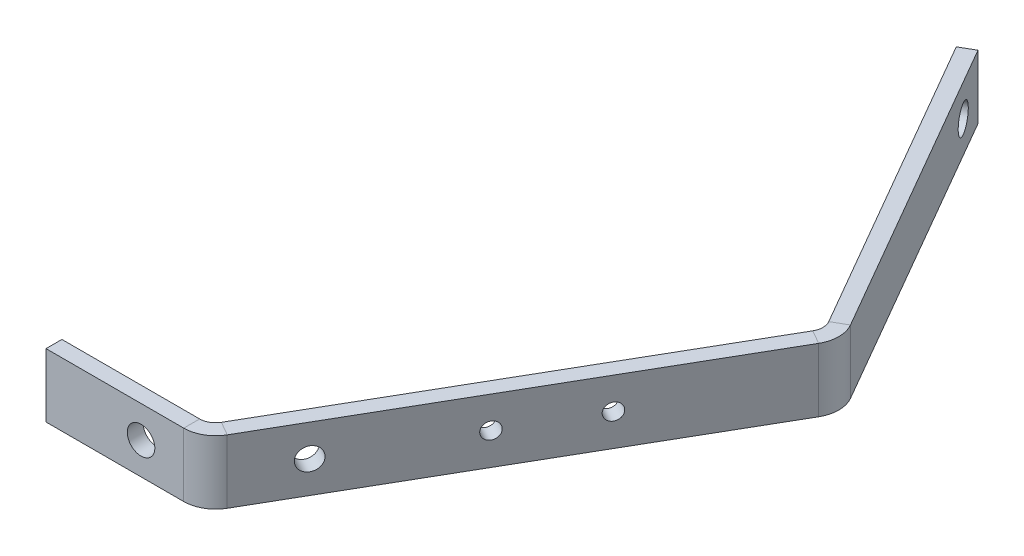
from build123d import *

# Parameters (mm, degrees)
ESBO_O2_W               = 193.5
ESBO_O2_H               = 12.7
FLANGE_BASE1_DEPTH      = 3.175
DOBRA_START             = -6.35
DOBRA_ESBO_ADA1_DEPTH   = 12.7
DOBRA_ESBO_ADA1_2_DEPTH = 12.7
DOBRA_ESBO_ADA2_DEPTH   = 12.7
DOBRA_ESBO_ADA2_2_DEPTH = 12.7
ESBO_O10_R              = 2.75
CORTE_EXTRUS_O2_DEPTH   = 10
ESBO_O11_R              = 2.75
CORTE_EXTRUS_O3_DEPTH   = 10
ESBO_O12_R              = 1.65
ESBO_O12_R_2            = 2.250000002
CORTE_EXTRUS_O4_DEPTH   = 10


# Read off the part's stored shape, not the designer's step: Dobra esboçada1, Dobra esboçada2
# Sheet-metal steps are written as plain solids
with BuildPart() as part:
    # Esboço2 → Flange-base1 (new body)
    with BuildSketch(Plane.XY):
        Rectangle(ESBO_O2_W, ESBO_O2_H)
    extrude(amount=-FLANGE_BASE1_DEPTH)

    # Dobra esboçada1 outline → Dobra esboçada1 (cut)
    with BuildSketch(Plane(origin=(0, 0, 0), x_dir=(1, 0, 0), z_dir=(0, 1, 0)).offset(DOBRA_START)):
        with BuildLine():
            Line((96.75, 3.175), (-63.744109855, 3.175))
            ThreePointArc((-63.744109855, 3.175), (-66.070007409, 0.850686918), (-69.246257163, 0))
            Line((-69.246257163, 0), (96.75, 0))
            Line((96.75, 0), (96.75, 3.175))
        make_face()
    extrude(amount=DOBRA_ESBO_ADA1_DEPTH, mode=Mode.SUBTRACT)

    # Dobra esbo_ada1 2 outline → Dobra esbo_ada1 2 (add)
    with BuildSketch(Plane(origin=(0, 0, 0), x_dir=(1, 0, 0), z_dir=(0, 1, 0)).offset(DOBRA_START)):
        with BuildLine():
            Line((16.759205697, 142.610831402), (14.00957504, 144.198331402))
            Line((14.00957504, 144.198331402), (-66.492296379, 4.765))
            ThreePointArc((-66.492296379, 4.765), (-67.656257163, 3.601039216), (-69.246257163, 3.175))
            Line((-69.246257163, 3.175), (-63.744109855, 3.175))
            ThreePointArc((-63.744109855, 3.175), (-63.743387647, 3.176249918), (-63.742665722, 3.1775))
            Line((-63.742665722, 3.1775), (16.759205697, 142.610831402))
        make_face()
    extrude(amount=DOBRA_ESBO_ADA1_2_DEPTH)

    # Dobra esboçada2 outline → Dobra esboçada2 (cut)
    with BuildSketch(Plane(origin=(0, 0, 0), x_dir=(1, 0, 0), z_dir=(0, 1, 0)).offset(DOBRA_START)):
        with BuildLine():
            Line((14.00957504, 144.198331402), (-20.519351306, 84.39247664))
            ThreePointArc((-20.519351306, 84.39247664), (-19.669385908, 81.21603373), (-20.520794303, 78.039977295))
            Line((-20.520794303, 78.039977295), (16.759205697, 142.610831402))
            Line((16.759205697, 142.610831402), (14.00957504, 144.198331402))
        make_face()
    extrude(amount=DOBRA_ESBO_ADA2_DEPTH, mode=Mode.SUBTRACT)

    # Dobra esbo_ada2 2 outline → Dobra esbo_ada2 2 (add)
    with BuildSketch(Plane(origin=(0, 0, 0), x_dir=(1, 0, 0), z_dir=(0, 1, 0)).offset(DOBRA_START)):
        with BuildLine():
            Line((-58.054167797, 143.054687167), (-23.27042496, 82.807477295))
            ThreePointArc((-23.27042496, 82.807477295), (-22.844385744, 81.217477295), (-23.27042496, 79.627477295))
            Line((-23.27042496, 79.627477295), (-20.519351306, 84.39247664))
            ThreePointArc((-20.519351306, 84.39247664), (-20.520072663, 84.393727049), (-20.520794303, 84.394977295))
            Line((-20.520794303, 84.394977295), (-55.30453714, 144.642187167))
            Line((-55.30453714, 144.642187167), (-58.054167797, 143.054687167))
        make_face()
    extrude(amount=DOBRA_ESBO_ADA2_2_DEPTH)

    # Esboço10 → Corte-extrusão2 (cut)
    with BuildSketch(Plane(origin=(18.403870761, 0, -10.625479738), x_dir=(0.5000000000000041, 0, 0.8660254037844364), z_dir=(-0.8660254037844363, 0, 0.500000000000004))):
        with Locations((-144.864192108, 0)):
            Circle(ESBO_O10_R)
    extrude(amount=-CORTE_EXTRUS_O2_DEPTH, mode=Mode.SUBTRACT)

    # Esboço11 → Corte-extrusão3 (cut)
    with BuildSketch(Plane(origin=(0, 0, -3.175), x_dir=(-1, 0, 0), z_dir=(0, 0, -1))):
        with Locations((77.77220064, 0)):
            Circle(ESBO_O11_R)
    extrude(amount=-CORTE_EXTRUS_O3_DEPTH, mode=Mode.SUBTRACT)

    # Esboço12 → Corte-extrusão4 (cut)
    with BuildSketch(Plane(origin=(-51.932527808, 0, -29.98325891), x_dir=(-0.49999999999999806, 0, 0.8660254037844398), z_dir=(-0.8660254037844397, 0, -0.499999999999998))):
        with Locations((-27.332391374, 0.04)):
            Circle(ESBO_O12_R)
        with Locations((17.064458437, 0)):
            Circle(ESBO_O12_R_2)
        with Locations((-9.431391374, 0.04)):
            Circle(ESBO_O12_R)
    extrude(amount=-CORTE_EXTRUS_O4_DEPTH, mode=Mode.SUBTRACT)


solid = part.part
